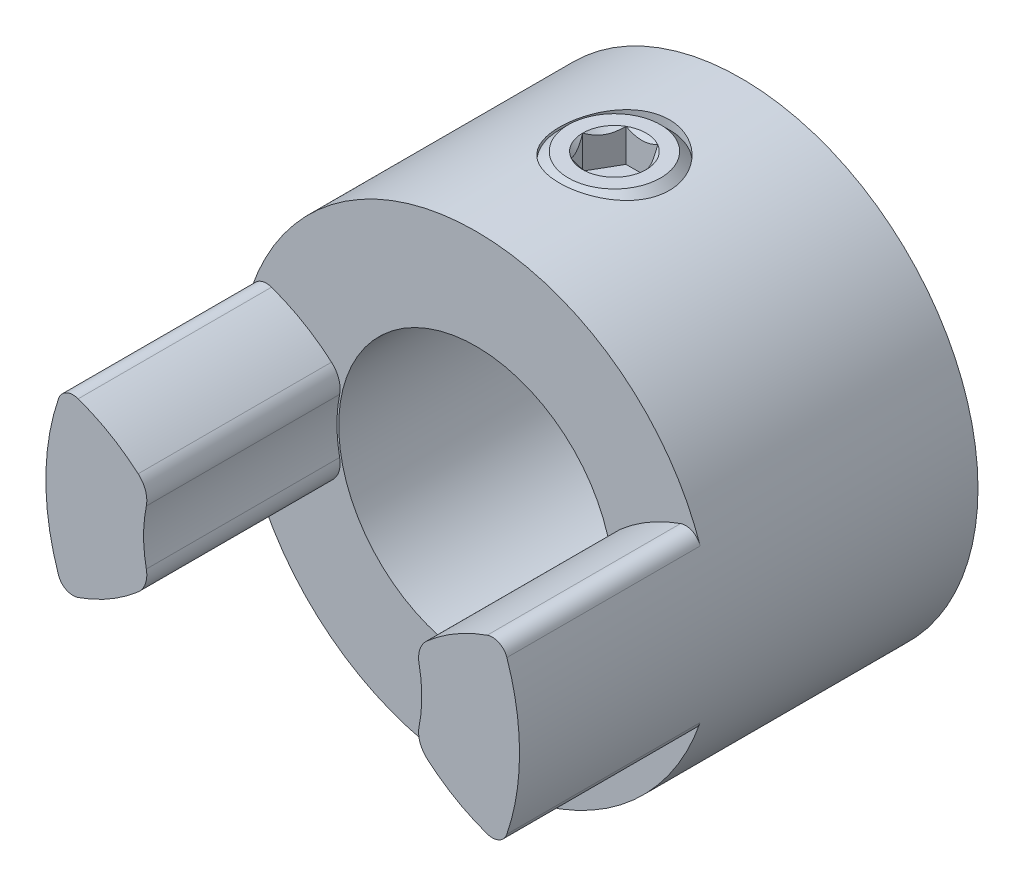
from build123d import *
from OCP.BRepFilletAPI import BRepFilletAPI_MakeChamfer

# Parameters (mm, degrees)
BOSS_EXTRUDE1_START     = -5.953125
SKETCH1_R               = 13.6921875
BOSS_EXTRUDE1_DEPTH     = 15.875
BOSS_EXTRUDE5_START     = 11.176
BOSS_EXTRUDE5_DEPTH     = 11.176
MOVE_START              = -5.953125
MOVE_FACE1_DEPTH        = 11.176
MOVE_FACE1_2_DEPTH      = 11.176
CIRPATTERN3_START       = -5.953125
CIRPATTERN3_DEPTH       = 11.176
CUT_EXTRUDE5_DEPTH      = 30.179085628
CUT_EXTRUDE5_DEPTH_BACK = 30.179085628
SKETCH15_R              = 7.9375
CHAMFER1_SIZE           = 0.5476875
CHAMFER1_SIZE2          = 0.81198011
SKETCH5_R               = 3.175
CUT_EXTRUDE2_DEPTH      = 30.179085628
SKETCH6_R               = 3.175
BOSS_EXTRUDE3_DEPTH     = 6.35
CUT_EXTRUDE3_DEPTH      = 1.905
CHAMFER3_SIZE           = 0.508
CHAMFER4_SIZE           = 1.0795


# Read off the part's stored shape, not the designer's step: Move Face1, CirPattern3
with BuildPart() as part:
    # Sketch1 → Boss-Extrude1 (new body)
    with BuildSketch(Plane.XY.offset(BOSS_EXTRUDE1_START)):
        Circle(SKETCH1_R)
    extrude(amount=-BOSS_EXTRUDE1_DEPTH)

    # Sketch11 → Boss-Extrude5 (add)
    with BuildSketch(Plane.XY.offset(-5.953125).offset(BOSS_EXTRUDE5_START)):
        with BuildLine():
            ThreePointArc((-1.582501, -7.883505579), (-0.004369034, -8.040686324), (1.573762932, -7.883505579))
            ThreePointArc((1.573762932, -7.883505579), (2.326569083, -7.932638836), (2.952339417, -8.353996958))
            ThreePointArc((2.952339417, -8.353996958), (4.124174772, -9.993538922), (4.969226713, -11.823069782))
            ThreePointArc((4.969226713, -11.823069782), (4.930575443, -12.50660364), (4.417578974, -12.959976641))
            ThreePointArc((4.417578974, -12.959976641), (-0.006979455, -13.692185721), (-4.430789112, -12.955466274))
            ThreePointArc((-4.430789112, -12.955466274), (-4.941191352, -12.503649266), (-4.979409431, -11.823069782))
            ThreePointArc((-4.979409431, -11.823069782), (-4.13390788, -9.993483356), (-2.961583815, -8.353996958))
            ThreePointArc((-2.961583815, -8.353996958), (-2.335546152, -7.932611995), (-1.582501, -7.883505579))
        make_face()
    extrude(amount=-BOSS_EXTRUDE5_DEPTH)

    # Move Face1 outline → Move Face1 (cut)
    with BuildSketch(Plane.XY.offset(MOVE_START)):
        with BuildLine():
            ThreePointArc((-4.430789112, -12.955466274), (-0.006979455, -13.692185721), (4.417578974, -12.959976641))
            ThreePointArc((4.417578974, -12.959976641), (4.930575443, -12.50660364), (4.969226713, -11.823069782))
            ThreePointArc((4.969226713, -11.823069782), (4.124174772, -9.993538922), (2.952339417, -8.353996958))
            ThreePointArc((2.952339417, -8.353996958), (2.326569083, -7.932638836), (1.573762932, -7.883505579))
            ThreePointArc((1.573762932, -7.883505579), (-0.004369034, -8.040686324), (-1.582501, -7.883505579))
            ThreePointArc((-1.582501, -7.883505579), (-2.335546152, -7.932611995), (-2.961583815, -8.353996958))
            ThreePointArc((-2.961583815, -8.353996958), (-4.13390788, -9.993483356), (-4.979409431, -11.823069782))
            ThreePointArc((-4.979409431, -11.823069782), (-4.941191352, -12.503649266), (-4.430789112, -12.955466274))
        make_face()
    extrude(amount=MOVE_FACE1_DEPTH, mode=Mode.SUBTRACT)

    # Move Face1 2 outline → Move Face1 2 (add)
    with BuildSketch(Plane.XY.offset(MOVE_START)):
        with BuildLine():
            ThreePointArc((7.883505579, -1.582501), (7.932611995, -2.335546152), (8.353996958, -2.961583815))
            ThreePointArc((8.353996958, -2.961583815), (9.993483356, -4.13390788), (11.823069782, -4.979409431))
            ThreePointArc((11.823069782, -4.979409431), (12.503649266, -4.941191352), (12.955466274, -4.430789112))
            ThreePointArc((12.955466274, -4.430789112), (13.692185721, -0.006979455), (12.959976641, 4.417578974))
            ThreePointArc((12.959976641, 4.417578974), (12.50660364, 4.930575443), (11.823069782, 4.969226713))
            ThreePointArc((11.823069782, 4.969226713), (9.993538922, 4.124174772), (8.353996958, 2.952339417))
            ThreePointArc((8.353996958, 2.952339417), (7.932638836, 2.326569083), (7.883505579, 1.573762932))
            ThreePointArc((7.883505579, 1.573762932), (8.040686324, -0.004369034), (7.883505579, -1.582501))
        make_face()
    extrude(amount=MOVE_FACE1_2_DEPTH)

    # CirPattern3 outline → CirPattern3 (add)
    with BuildSketch(Plane.XY.offset(CIRPATTERN3_START)):
        with BuildLine():
            ThreePointArc((-7.883505579, 1.582501), (-7.932611995, 2.335546152), (-8.353996958, 2.961583815))
            ThreePointArc((-8.353996958, 2.961583815), (-9.993483356, 4.13390788), (-11.823069782, 4.979409431))
            ThreePointArc((-11.823069782, 4.979409431), (-12.503649266, 4.941191352), (-12.955466274, 4.430789112))
            ThreePointArc((-12.955466274, 4.430789112), (-13.692185721, 0.006979455), (-12.959976641, -4.417578974))
            ThreePointArc((-12.959976641, -4.417578974), (-12.50660364, -4.930575443), (-11.823069782, -4.969226713))
            ThreePointArc((-11.823069782, -4.969226713), (-9.993538922, -4.124174772), (-8.353996958, -2.952339417))
            ThreePointArc((-8.353996958, -2.952339417), (-7.932638836, -2.326569083), (-7.883505579, -1.573762932))
            ThreePointArc((-7.883505579, -1.573762932), (-8.040686324, 0.004369034), (-7.883505579, 1.582501))
        make_face()
    extrude(amount=CIRPATTERN3_DEPTH)

    # Sketch15 → Cut-Extrude5 (cut, two sides: drawn at the far end of the back side and taken through both)
    with BuildSketch(Plane.XY.offset(-CUT_EXTRUDE5_DEPTH_BACK)):
        Circle(SKETCH15_R)
    extrude(amount=CUT_EXTRUDE5_DEPTH + CUT_EXTRUDE5_DEPTH_BACK, mode=Mode.SUBTRACT)

    # Chamfer1: one chamfer whose edges measure the first distance from different faces: ONE call of the kernel's chamfer builder (chamfer() names one face for all edges)
    chamfer1_edges_1 = [part.edges().sort_by_distance(p)[0] for p in [
        (-13.6921875, 0, -21.828125),
    ]]
    chamfer1_side_1 = [part.faces().sort_by_distance(p)[0] for p in [
        (-13.6921875, 0, -13.890625),
    ]]
    chamfer1_edges_2 = [part.edges().sort_by_distance(p)[0] for p in [
        (-7.9375, 0, -21.828125),
    ]]
    chamfer1_side_2 = [part.faces().sort_by_distance(p)[0] for p in [
        (-7.9375, 0, -13.890625),
    ]]
    chamfer1 = BRepFilletAPI_MakeChamfer(part.part.solid().wrapped)
    for e in chamfer1_edges_1:
        chamfer1.Add(CHAMFER1_SIZE, CHAMFER1_SIZE2, e.wrapped, chamfer1_side_1[0].wrapped)  # the first distance lies on this face
    for e in chamfer1_edges_2:
        chamfer1.Add(CHAMFER1_SIZE, CHAMFER1_SIZE2, e.wrapped, chamfer1_side_2[0].wrapped)  # the first distance lies on this face
    add(Compound.cast(chamfer1.Shape()), mode=Mode.REPLACE)

    # Sketch5 → Cut-Extrude2 (cut, through all)
    with BuildSketch(Plane(origin=(0, 0, 0), x_dir=(1, 0, 0), z_dir=(0, 1, 0))):
        with Locations(Location((0, 13.954125, 0), (0, 0, 90))):
            Circle(SKETCH5_R)
    extrude(amount=CUT_EXTRUDE2_DEPTH, mode=Mode.SUBTRACT)


with BuildPart() as body_2:
    # Sketch6 → Boss-Extrude3 (new body)
    with BuildSketch(Plane(origin=(0, 13.6921875, 0), x_dir=(-1, 0, 0), z_dir=(0, 1, 0))):
        with Locations(Location((0, -13.954125, 0), (0, 0, 90))):
            Circle(SKETCH6_R)
    extrude(amount=-BOSS_EXTRUDE3_DEPTH)

    # Sketch8 → Cut-Extrude3 (cut)
    with BuildSketch(Plane(origin=(0, 13.6921875, 0), x_dir=(1, 0, 0), z_dir=(0, 1, 0))):
        Polygon((0.916543552, 12.366625), (1.833087105, 13.954125), (0.916543552, 15.541625), (-0.916543552, 15.541625), (-1.833087105, 13.954125), (-0.916543552, 12.366625), align=None)
    extrude(amount=-CUT_EXTRUDE3_DEPTH, mode=Mode.SUBTRACT)

    # Cut-Extrude4 cone 1 section (through the dimple's axis) → Cut-Extrude4 (revolve, cut)
    with BuildSketch(Plane(origin=(0, 13.6921875, -13.954125), x_dir=(0, 0, 1), z_dir=(1, 0, 0))):
        Polygon((0, 0), (1.833087105, 0), (0, 1.833087105), align=None)
    revolve(axis=Axis((0, 13.6921875, -13.954125), (0, -1, 0)), mode=Mode.SUBTRACT)

    # Chamfer3
    chamfer3_edges = [body_2.edges().sort_by_distance(p)[0] for p in [
        (0, 13.6921875, -17.129125),
    ]]
    chamfer(chamfer3_edges, length=CHAMFER3_SIZE)

    # Chamfer4
    chamfer4_edges = [body_2.edges().sort_by_distance(p)[0] for p in [
        (0, 7.3421875, -17.129125),
    ]]
    chamfer(chamfer4_edges, length=CHAMFER4_SIZE)


solid = Compound([part.part, body_2.part])
